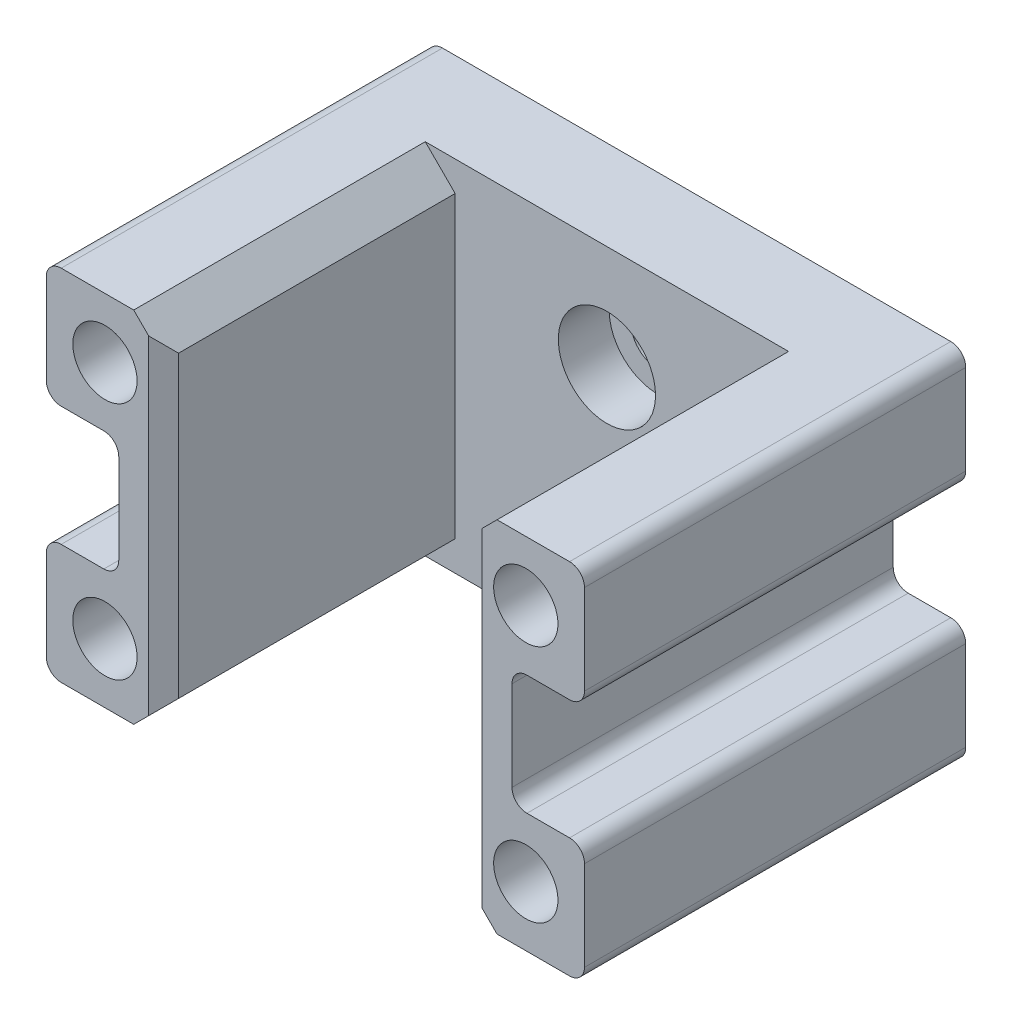
from build123d import *

# Parameters (mm, degrees)
SKETCH1_W                                           = 36
SKETCH1_H                                           = 24
BOSS_EXTRUDE1_DEPTH                                 = 6
CBORE_FOR_M3_HEX_SOCKET_HEAD_CAP_SCREW1_D           = 3.6
CBORE_FOR_M3_HEX_SOCKET_HEAD_CAP_SCREW1_DEPTH       = 12
CBORE_FOR_M3_HEX_SOCKET_HEAD_CAP_SCREW1_CBORE_D     = 6.5
CBORE_FOR_M3_HEX_SOCKET_HEAD_CAP_SCREW1_CBORE_DEPTH = 3.4
CBORE_FOR_M3_HEX_SOCKET_HEAD_CAP_SCREW1_TIP         = 1.081549114
BOSS_EXTRUDE2_DEPTH                                 = 19.5
SKETCH5_W                                           = 4.85
SKETCH5_H                                           = 8
CUT_EXTRUDE1_DEPTH                                  = 48.457876059
F_4_3_4_3_DIAMETER_HOLE1_D                          = 4.3
F_4_3_4_3_DIAMETER_HOLE1_DEPTH                      = 16
F_4_3_4_3_DIAMETER_HOLE1_TIP                        = 1.291850331
FILLET1_R                                           = 1
CHAMFER1_SIZE                                       = 2
CHAMFER2_SIZE                                       = 1


with BuildPart() as part:
    # Sketch1 → Boss-Extrude1 (new body)
    with BuildSketch(Plane.XY):
        with Locations((18, 12)):
            Rectangle(SKETCH1_W, SKETCH1_H)
    extrude(amount=BOSS_EXTRUDE1_DEPTH)

    # CBORE for M3 Hex Socket Head Cap Screw1
    with Locations(Plane.XY.offset(6)):
        with Locations((18, 17), (18, 7)):
            CounterBoreHole(CBORE_FOR_M3_HEX_SOCKET_HEAD_CAP_SCREW1_D / 2, CBORE_FOR_M3_HEX_SOCKET_HEAD_CAP_SCREW1_CBORE_D / 2, CBORE_FOR_M3_HEX_SOCKET_HEAD_CAP_SCREW1_CBORE_DEPTH, depth=CBORE_FOR_M3_HEX_SOCKET_HEAD_CAP_SCREW1_DEPTH)
            with Locations((0, 0, -(CBORE_FOR_M3_HEX_SOCKET_HEAD_CAP_SCREW1_DEPTH + CBORE_FOR_M3_HEX_SOCKET_HEAD_CAP_SCREW1_TIP / 2))):  # 118° drill point
                Cone(0, CBORE_FOR_M3_HEX_SOCKET_HEAD_CAP_SCREW1_D / 2, CBORE_FOR_M3_HEX_SOCKET_HEAD_CAP_SCREW1_TIP, mode=Mode.SUBTRACT)

    # Sketch4 → Boss-Extrude2 (add)
    with BuildSketch(Plane.XY.offset(6)):
        Polygon((7.85, 24), (0, 24), (0, 16), (4.85, 16), (4.85, 8), (0, 8), (0, 0), (7.85, 0), align=None)
        Polygon((36, 24), (28.15, 24), (28.15, 0), (36, 0), (36, 8), (31.15, 8), (31.15, 16), (36, 16), align=None)
    extrude(amount=BOSS_EXTRUDE2_DEPTH)

    # Sketch5 → Cut-Extrude1 (cut, through all)
    with BuildSketch(Plane.XY.offset(6)):
        with Locations((33.575, 12)):
            Rectangle(SKETCH5_W, SKETCH5_H)
        with Locations((2.425, 12)):
            Rectangle(SKETCH5_W, SKETCH5_H)
    extrude(amount=-CUT_EXTRUDE1_DEPTH, mode=Mode.SUBTRACT)

    # Ø4.3 (4.3) Diameter Hole1
    with Locations(Plane.XY.offset(25.5)):
        with Locations((3.925, 20), (3.925, 4), (32.075, 4), (32.075, 20)):
            Hole(F_4_3_4_3_DIAMETER_HOLE1_D / 2, depth=F_4_3_4_3_DIAMETER_HOLE1_DEPTH)
            with Locations((0, 0, -(F_4_3_4_3_DIAMETER_HOLE1_DEPTH + F_4_3_4_3_DIAMETER_HOLE1_TIP / 2))):  # 118° drill point
                Cone(0, F_4_3_4_3_DIAMETER_HOLE1_D / 2, F_4_3_4_3_DIAMETER_HOLE1_TIP, mode=Mode.SUBTRACT)

    # Fillet1
    fillet1_edges = [part.edges().sort_by_distance(p)[0] for p in [
        (31.15, 8, 12.75),
        (31.15, 16, 12.75),
        (36, 24, 12.75),
        (36, 8, 12.75),
        (36, 16, 12.75),
        (36, 0, 12.75),
        (4.85, 16, 12.75),
        (0, 16, 12.75),
        (4.85, 8, 12.75),
        (0, 8, 12.75),
        (0, 0, 12.75),
        (0, 24, 12.75),
    ]]
    fillet(fillet1_edges, radius=FILLET1_R)

    # Chamfer1
    chamfer1_edges = [part.edges().sort_by_distance(p)[0] for p in [
        (28.15, 0, 15.75),
        (7.85, 0, 15.75),
        (28.15, 24, 15.75),
        (7.85, 24, 15.75),
    ]]
    chamfer(chamfer1_edges, length=CHAMFER1_SIZE)

    # Chamfer2
    chamfer2_edges = [part.edges().sort_by_distance(p)[0] for p in [
        (28.15, 12, 25.5),
        (7.85, 12, 25.5),
    ]]
    chamfer(chamfer2_edges, length=CHAMFER2_SIZE)


solid = part.part
